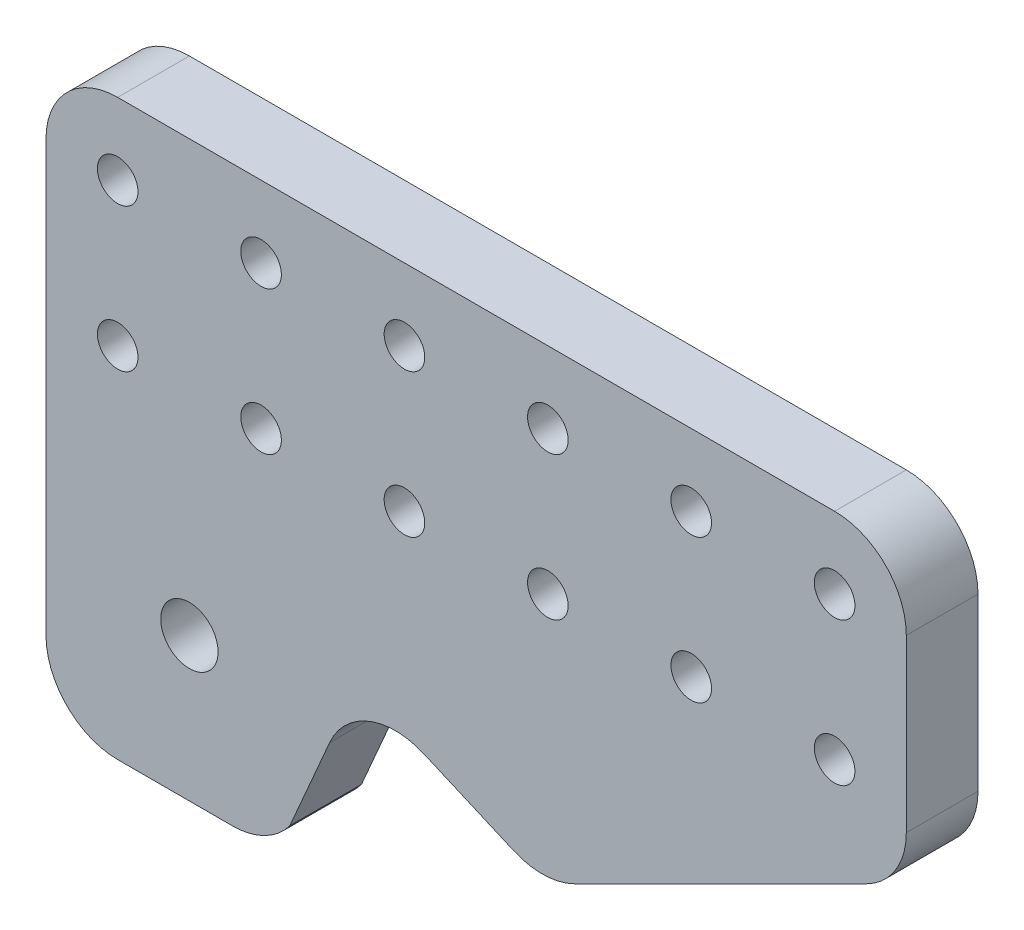
from build123d import *

# Parameters (mm, degrees)
SKETCH1_R           = 2.54
SKETCH1_R_2         = 1.797730585
BOSS_EXTRUDE1_DEPTH = 6.35
CUT_EXTRUDE1_DEPTH  = 92.800885072
FILLET1_R           = 6.35


with BuildPart() as part:
    # Sketch1 → Boss-Extrude1 (new body)
    with BuildSketch(Plane.XY):
        Polygon((25.4, 0), (76.2, 25.4), (76.2, 50.8), (0, 50.8), (0, 0), align=None)
        with Locations((12.7, 12.7)):
            Circle(SKETCH1_R, mode=Mode.SUBTRACT)
        with Locations((69.85, 44.45)):
            Circle(SKETCH1_R_2, mode=Mode.SUBTRACT)
        with Locations((57.15, 44.45)):
            Circle(SKETCH1_R_2, mode=Mode.SUBTRACT)
        with Locations((44.45, 44.45)):
            Circle(SKETCH1_R_2, mode=Mode.SUBTRACT)
        with Locations((31.75, 44.45)):
            Circle(SKETCH1_R_2, mode=Mode.SUBTRACT)
        with Locations((19.05, 44.45)):
            Circle(SKETCH1_R_2, mode=Mode.SUBTRACT)
        with Locations((6.35, 44.45)):
            Circle(SKETCH1_R_2, mode=Mode.SUBTRACT)
        with Locations((57.15, 31.75)):
            Circle(SKETCH1_R_2, mode=Mode.SUBTRACT)
        with Locations((44.45, 31.75)):
            Circle(SKETCH1_R_2, mode=Mode.SUBTRACT)
        with Locations((31.75, 31.75)):
            Circle(SKETCH1_R_2, mode=Mode.SUBTRACT)
        with Locations((19.05, 31.75)):
            Circle(SKETCH1_R_2, mode=Mode.SUBTRACT)
        with Locations((6.35, 31.75)):
            Circle(SKETCH1_R_2, mode=Mode.SUBTRACT)
        with Locations((69.85, 31.75)):
            Circle(SKETCH1_R_2, mode=Mode.SUBTRACT)
    extrude(amount=BOSS_EXTRUDE1_DEPTH)

    # Sketch2 → Cut-Extrude1 (cut, through all)
    with BuildSketch(Plane.XY.offset(6.35)):
        Polygon((21.59, 0), (21.59, 2.54), (27.65106415, 16.522886017), (44.145936938, 9.372968469), (25.4, 0), align=None)
    extrude(amount=-CUT_EXTRUDE1_DEPTH, mode=Mode.SUBTRACT)

    # Fillet1
    # the kernel refuses this fillet: 6.35 mm, written as the material it adds along each edge
    with BuildSketch(Plane(origin=(27.65106415, 16.522886017, 6.35), x_dir=(0.9175122058614823, -0.397707621369263, 0), z_dir=(0, 0, -1))) as fillet1_piece_1:
        with BuildLine():
            CenterArc((FILLET1_R, FILLET1_R), FILLET1_R, 180, 90)
            Line((0, FILLET1_R), (0, 0))
            Line((0, 0), (FILLET1_R, 0))
        make_face()
    extrude(amount=6.35)
    # the kernel refuses this fillet: 6.35 mm, written as the material it takes off along each edge
    with BuildSketch(Plane(origin=(44.145936938, 9.372968469, 13.752634073), x_dir=(0.8944271909999154, 0.4472135954999589, 0), z_dir=(0, 0, -1))) as fillet1_2_piece_1:
        with BuildLine():
            CenterArc((FILLET1_R * 0.466307658155, -FILLET1_R), FILLET1_R, 90, 50)
            Line((-FILLET1_R * 0.299736784964, -FILLET1_R * 0.357212390313), (0, 0))
            Line((0, 0), (FILLET1_R * 0.466307658155, 0))
        make_face()
    extrude(amount=21.155268146, mode=Mode.SUBTRACT)
    with BuildSketch(Plane(origin=(76.2, 25.4, -9.811289571), x_dir=(-0.8944271909999166, -0.4472135954999565, 0), z_dir=(0, 0, 1))) as fillet1_2_piece_2:
        with BuildLine():
            CenterArc((FILLET1_R * 0.61803398875, -FILLET1_R), FILLET1_R, 90, 63.434948823)
            Line((-FILLET1_R * 0.27639320225, -FILLET1_R * 0.5527864045), (0, 0))
            Line((0, 0), (FILLET1_R * 0.61803398875, 0))
        make_face()
    extrude(amount=25.972579143, mode=Mode.SUBTRACT)
    with BuildSketch(Plane(origin=(76.2, 50.8, -15.875), x_dir=(0, -1, 0), z_dir=(0, 0, 1))) as fillet1_2_piece_3:
        with BuildLine():
            CenterArc((FILLET1_R, -FILLET1_R), FILLET1_R, 90, 90)
            Line((0, -FILLET1_R), (0, 0))
            Line((0, 0), (FILLET1_R, 0))
        make_face()
    extrude(amount=38.1, mode=Mode.SUBTRACT)
    with BuildSketch(Plane(origin=(0, 50.8, -15.875), x_dir=(0, -1, 0), z_dir=(0, 0, 1)), Plane(origin=(0, 0, -15.875), x_dir=(1, 0, 0), z_dir=(0, 0, 1))) as fillet1_2_piece_4:
        with BuildLine():
            CenterArc((FILLET1_R, FILLET1_R), FILLET1_R, 180, 90)
            Line((0, FILLET1_R), (0, 0))
            Line((0, 0), (FILLET1_R, 0))
        make_face()
    extrude(amount=38.1, mode=Mode.SUBTRACT)
    with BuildSketch(Plane(origin=(21.59, 0, 19.05), x_dir=(0, 1, 0), z_dir=(0, 0, -1))) as fillet1_2_piece_5:
        with BuildLine():
            CenterArc((6.35, -5.08), FILLET1_R, 126.869897646, 53.130102354)
            Line((0, -5.08), (0, 0))
            Line((0, 0), (2.54, 0))
        make_face()
    extrude(amount=31.75, mode=Mode.SUBTRACT)


solid = part.part
